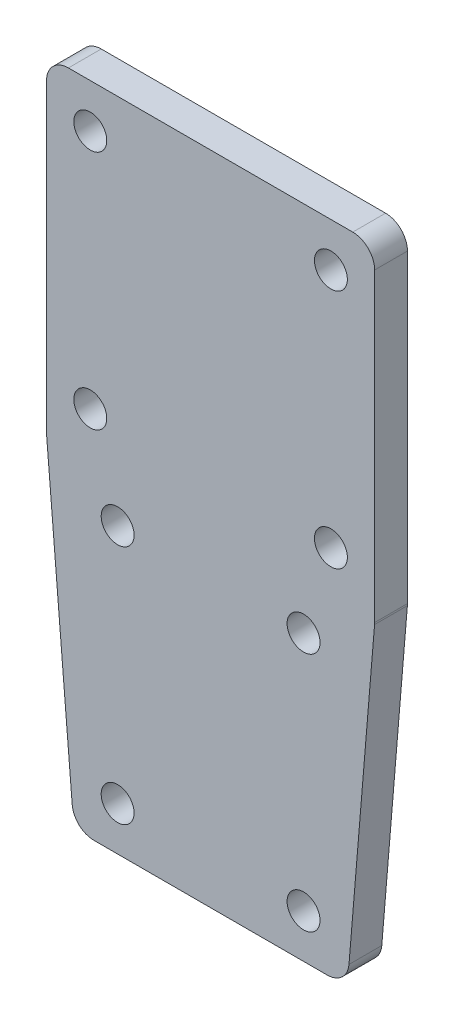
from build123d import *

# Parameters (mm, degrees)
SKETCH_1_W          = 30
SKETCH_1_H          = 30
SKETCH_1_W_2        = 25
EXTRUDE_1_DEPTH     = 1.5
EXTRUDE_2_DEPTH     = 3
SKETCH_5_R          = 1.505
CUT_EXTRUDE_2_DEPTH = 3
SKETCH_3_R          = 1.505
CUT_EXTRUDE_1_DEPTH = 3
FILLET_1_R          = 2


with BuildPart() as part:
    # 草图1 → 凸台-拉伸1 (new, symmetric)
    with BuildSketch(Plane.XY):
        Rectangle(SKETCH_1_W, SKETCH_1_H)
        with Locations((0, -30)):
            Rectangle(SKETCH_1_W_2, SKETCH_1_H)
    extrude(amount=EXTRUDE_1_DEPTH, both=True)

    # 草图2 → 凸台-拉伸2 (add)
    with BuildSketch(Plane.XY.offset(1.5)):
        Polygon((-15, -15), (-12.5, -45), (12.5, -45), (15, -15), align=None)
    extrude(amount=-EXTRUDE_2_DEPTH)

    # 草图5 → 切除-拉伸2 (cut)
    with BuildSketch(Plane(origin=(0, 0, -1.5), x_dir=(-1, 0, 0), z_dir=(0, 0, -1))):
        with Locations((-8.5, -19)):
            Circle(SKETCH_5_R)
        with Locations((8.5, -19)):
            Circle(SKETCH_5_R)
        with Locations((-8.5, -41)):
            Circle(SKETCH_5_R)
        with Locations((8.5, -41)):
            Circle(SKETCH_5_R)
    extrude(amount=-CUT_EXTRUDE_2_DEPTH, mode=Mode.SUBTRACT)

    # 草图3 → 切除-拉伸1 (cut)
    with BuildSketch(Plane(origin=(0, 0, -1.5), x_dir=(-1, 0, 0), z_dir=(0, 0, -1))):
        with Locations((-11, 11)):
            Circle(SKETCH_3_R)
        with Locations((11, 11)):
            Circle(SKETCH_3_R)
        with Locations((-11, -11)):
            Circle(SKETCH_3_R)
        with Locations((11, -11)):
            Circle(SKETCH_3_R)
    extrude(amount=-CUT_EXTRUDE_1_DEPTH, mode=Mode.SUBTRACT)

    # 圆角1
    # the kernel refuses this fillet: 2 mm, written as the material it takes off along each edge
    with BuildSketch(Plane(origin=(-15, -15, 1.707972894), x_dir=(0, 1, 0), z_dir=(0, 0, -1)), Plane(origin=(15, -15, -1.707972894), x_dir=(0, 1, 0), z_dir=(0, 0, 1))) as fillet_1_piece_1:
        with BuildLine():
            CenterArc((FILLET_1_R * 0.0415945787923, FILLET_1_R), FILLET_1_R, 265.236358309, 4.763641691)
            Line((-FILLET_1_R * 0.0414509010614, FILLET_1_R * 0.00345424175512), (0, 0))
            Line((0, 0), (FILLET_1_R * 0.0415945787923, 0))
        make_face()
    extrude(amount=3.415945788, mode=Mode.SUBTRACT)
    with BuildSketch(Plane(origin=(-15, 15, 6.5), x_dir=(0, -1, 0), z_dir=(0, 0, -1))) as fillet_1_piece_2:
        with BuildLine():
            CenterArc((FILLET_1_R, -FILLET_1_R), FILLET_1_R, 90, 90)
            Line((0, -FILLET_1_R), (0, 0))
            Line((0, 0), (FILLET_1_R, 0))
        make_face()
    extrude(amount=13, mode=Mode.SUBTRACT)
    with BuildSketch(Plane(origin=(15, 15, -6.5), x_dir=(-1, 0, 0), z_dir=(0, 0, 1))) as fillet_1_piece_3:
        with BuildLine():
            CenterArc((FILLET_1_R, FILLET_1_R), FILLET_1_R, 180, 90)
            Line((0, FILLET_1_R), (0, 0))
            Line((0, 0), (FILLET_1_R, 0))
        make_face()
    extrude(amount=13, mode=Mode.SUBTRACT)
    with BuildSketch(Plane(origin=(12.5, -45, 6.100664408), x_dir=(-1, 0, 0), z_dir=(0, 0, -1))) as fillet_1_piece_4:
        with BuildLine():
            CenterArc((FILLET_1_R * 0.920132881566, FILLET_1_R), FILLET_1_R, 184.763641691, 85.236358309)
            Line((-FILLET_1_R * 0.0764128766789, FILLET_1_R * 0.916954520146), (0, 0))
            Line((0, 0), (FILLET_1_R * 0.920132881566, 0))
        make_face()
    extrude(amount=12.201328816, mode=Mode.SUBTRACT)
    with BuildSketch(Plane(origin=(-12.5, -45, -6.100664408), x_dir=(-0.08304547985374029, 0.9965457582448797, 0), z_dir=(0, 0, 1))) as fillet_1_piece_5:
        with BuildLine():
            CenterArc((FILLET_1_R * 0.920132881566, -FILLET_1_R), FILLET_1_R, 90, 85.236358309)
            Line((-FILLET_1_R * 0.0764128766789, -FILLET_1_R * 0.916954520146), (0, 0))
            Line((0, 0), (FILLET_1_R * 0.920132881566, 0))
        make_face()
    extrude(amount=12.201328816, mode=Mode.SUBTRACT)


solid = part.part
